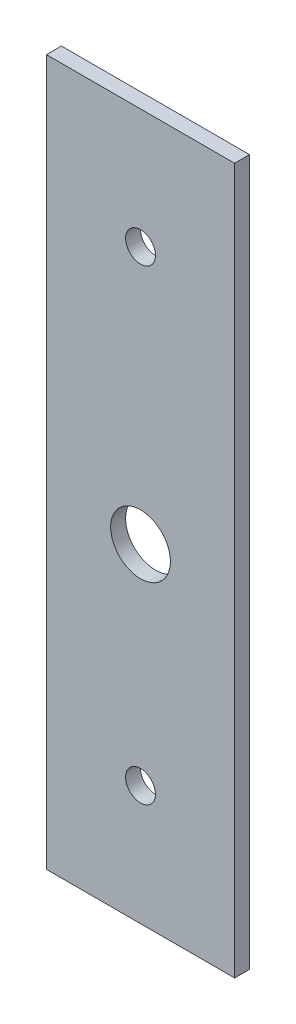
from build123d import *

# Parameters (mm, degrees)
SKETCH1_W          = 40
SKETCH1_H          = 150
SKETCH1_R          = 6.35
SKETCH1_R_2        = 3.175
BASE_FLANGE1_DEPTH = 3.175


# Sheet-metal steps are written as plain solids
with BuildPart() as part:
    # Sketch1 → Base-Flange1 (new body)
    with BuildSketch(Plane.XY):
        with Locations((20, 75)):
            Rectangle(SKETCH1_W, SKETCH1_H)
        with Locations((20, 69.85)):
            Circle(SKETCH1_R, mode=Mode.SUBTRACT)
        with Locations((20, 25.4)):
            Circle(SKETCH1_R_2, mode=Mode.SUBTRACT)
        with Locations((20, 124.6)):
            Circle(SKETCH1_R_2, mode=Mode.SUBTRACT)
    extrude(amount=-BASE_FLANGE1_DEPTH)


solid = part.part
